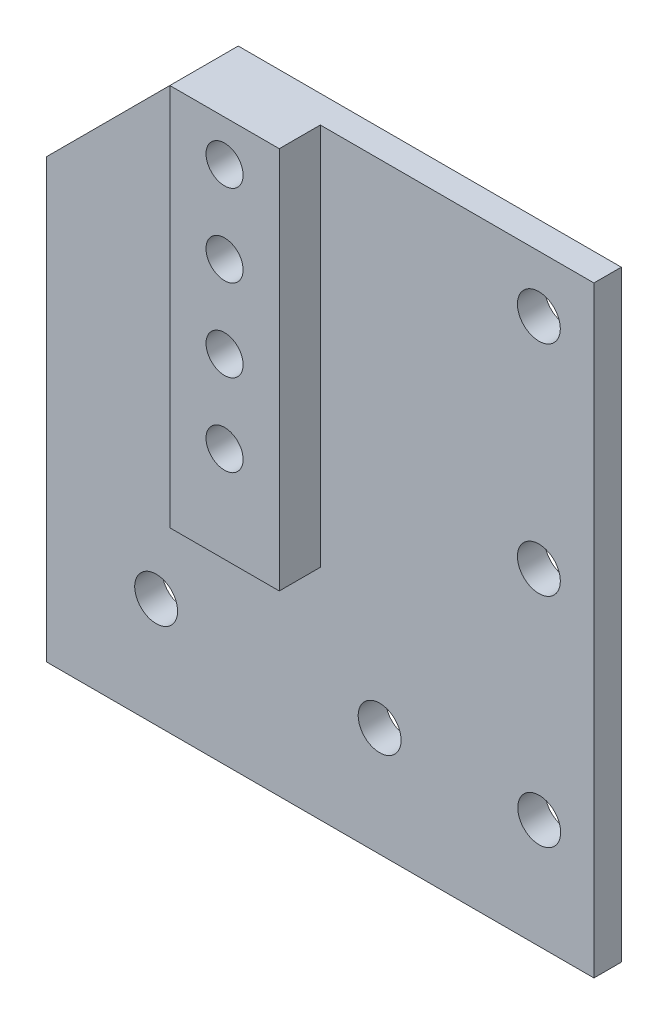
from build123d import *

# Parameters (mm, degrees)
BOSS_EXTRUDE1_DEPTH    = 3.175
F_10_CLEARANCE_HOLE1_D = 4.9784
SKETCH5_W              = 12.7
SKETCH5_H              = 44.45
BOSS_EXTRUDE2_DEPTH    = 4.7625
F_8_CLEARANCE_HOLE1_D  = 4.3053


with BuildPart() as part:
    # Sketch1 → Boss-Extrude1 (new body)
    with BuildSketch(Plane.XY):
        Polygon((-266.700000508, -12.7), (-266.700000508, 57.15), (-279.400000508, 57.15), (-311.150000508, 57.15), (-330.200000508, 38.1), (-330.200000508, 12.7), (-330.200000508, -12.7), (-279.400000508, -12.7), align=None)
    extrude(amount=BOSS_EXTRUDE1_DEPTH)

    # #10 Clearance Hole1 (through all)
    with Locations(Plane.XY.offset(3.175)):
        with Locations((-273.088229923, 50.598316496), (-273.088229923, 25.236545911), (-273.050000508, 0), (-291.564485652, 0), (-317.500000508, 0)):
            Hole(F_10_CLEARANCE_HOLE1_D / 2)

    # Sketch5 → Boss-Extrude2 (add)
    with BuildSketch(Plane.XY.offset(3.175)):
        with Locations((-304.800000508, 34.925)):
            Rectangle(SKETCH5_W, SKETCH5_H)
    extrude(amount=BOSS_EXTRUDE2_DEPTH)

    # #8 Clearance Hole1 (through all)
    with Locations(Plane.XY.offset(7.9375)):
        with Locations((-304.800000508, 42.8625), (-304.800000508, 52.3875), (-304.800000508, 33.3375), (-304.800000508, 23.8125)):
            Hole(F_8_CLEARANCE_HOLE1_D / 2)


solid = part.part
